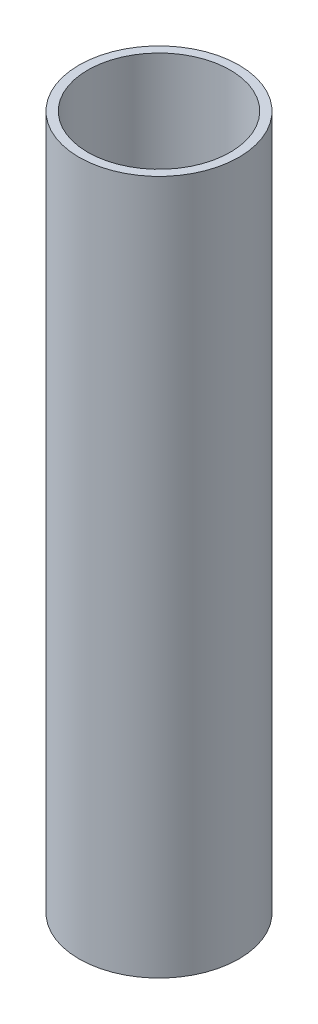
from build123d import *

# Parameters (mm, degrees)
SKETCH2_R           = 58.4835
SKETCH2_R_2         = 52.1335
BOSS_EXTRUDE1_DEPTH = 508


with BuildPart() as part:
    # Sketch2 → Boss-Extrude1 (new body)
    with BuildSketch(Plane(origin=(0, 0, 0), x_dir=(1, 0, 0), z_dir=(0, 1, 0))):
        Circle(SKETCH2_R)
        Circle(SKETCH2_R_2, mode=Mode.SUBTRACT)
    extrude(amount=BOSS_EXTRUDE1_DEPTH)


solid = part.part
